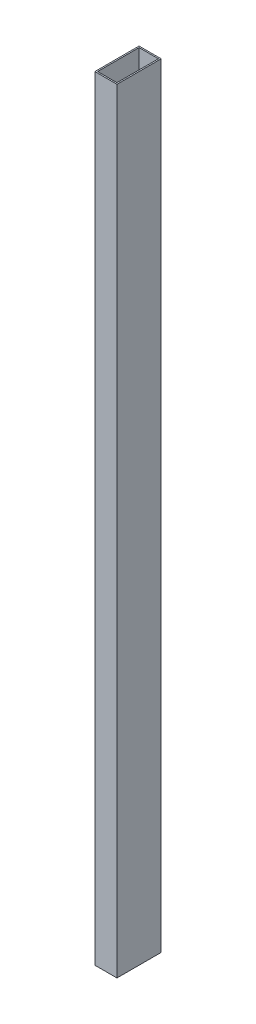
from build123d import *

# Parameters (mm, degrees)
SKETCH1_W           = 25.4
SKETCH1_H           = 50.8
SKETCH1_W_2         = 22.225
SKETCH1_H_2         = 47.625
EXTRUDE_THIN1_DEPTH = 889


with BuildPart() as part:
    # Sketch1 → Extrude-Thin1 (new body)
    with BuildSketch(Plane(origin=(0, 0, 0), x_dir=(1, 0, 0), z_dir=(0, 1, 0))):
        Rectangle(SKETCH1_W, SKETCH1_H)
        Rectangle(SKETCH1_W_2, SKETCH1_H_2, mode=Mode.SUBTRACT)
    extrude(amount=EXTRUDE_THIN1_DEPTH)


solid = part.part
